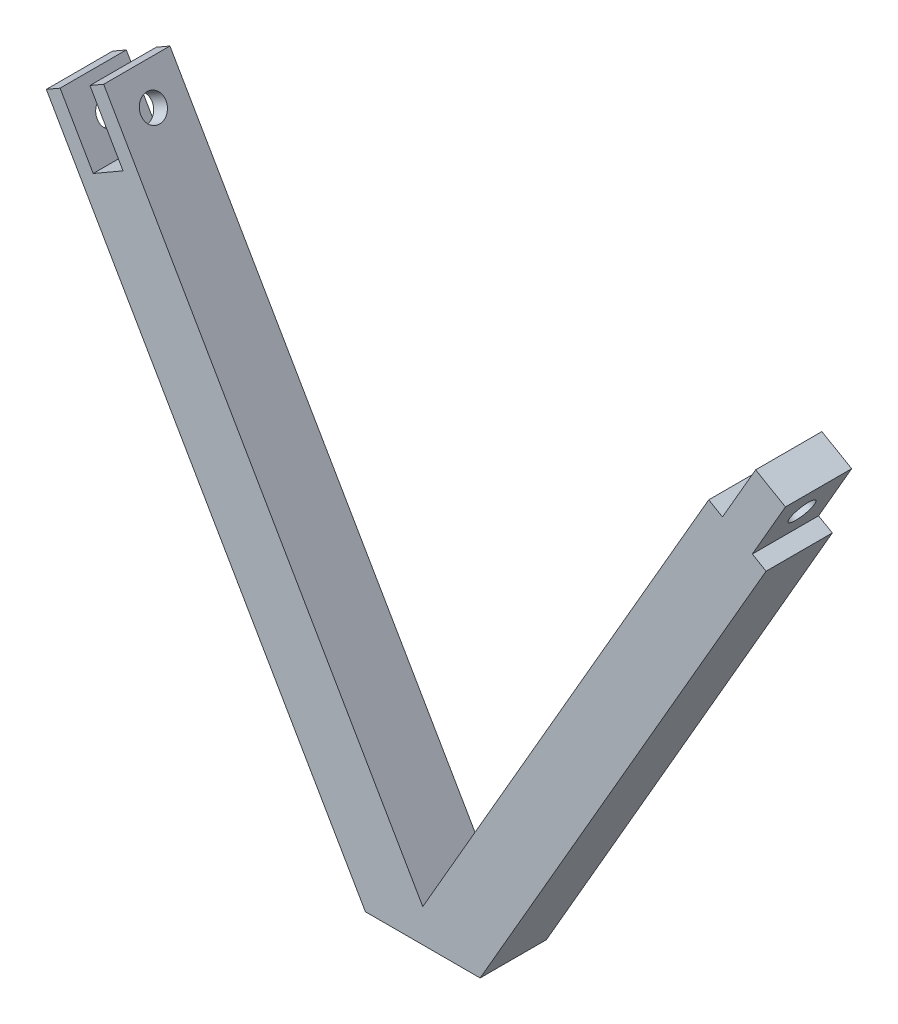
from build123d import *

# Parameters (mm, degrees)
SKETCH1_W               = 5
SKETCH1_H               = 5
SKETCH1_R               = 0.95
CENTER_DEPTH            = 1.3
RIGHTSIDE_START         = 1.3
SKETCH1_2_W             = 5
SKETCH1_2_H             = 5
SKETCH1_2_R             = 0.95
RIGHTSIDE_DEPTH         = 1.2
LEFTSIDE_START          = -1.3
SKETCH1_3_W             = 5
SKETCH1_3_H             = 5
SKETCH1_3_R             = 0.95
LEFTSIDE_DEPTH          = 1.2
SKETCH3_W               = 5
SKETCH3_H               = 5
BOSS_EXTRUDE4_DEPTH     = 47.5
CUT_EXTRUDE1_DEPTH      = 5
CIRPATTERN2_COUNT       = 6
CIRPATTERN3_COUNT       = 3
CIRPATTERN4_START       = -44.601270189
CIRPATTERN4_OUTLINE_W   = 5
CIRPATTERN4_OUTLINE_H   = 5
CIRPATTERN4_OUTLINE_R   = 0.95
CIRPATTERN4_DEPTH       = 2.6
CIRPATTERN4_2_OUTLINE_W = 5
CIRPATTERN4_2_OUTLINE_H = 5
CIRPATTERN4_2_OUTLINE_R = 0.95
CIRPATTERN4_2_DEPTH     = 2.6
CIRPATTERN4_START_2     = -1.3
CIRPATTERN4_3_OUTLINE_W = 5
CIRPATTERN4_3_OUTLINE_H = 5
CIRPATTERN4_3_OUTLINE_R = 0.95
CIRPATTERN4_3_DEPTH     = 2.6
SKETCH5_W               = 5
SKETCH5_H               = 2.6
CUT_EXTRUDE2_DEPTH      = 5
INTERSECT1_START        = -46.716333699
INTERSECT1_OUTLINE_W    = 105
INTERSECT1_OUTLINE_H    = 5
INTERSECT1_OUTLINE_R    = 0.95
INTERSECT1_DEPTH        = 49.216333699


# Read off the part's stored shape, not the designer's step: CirPattern4, Intersect1
with BuildPart() as part:
    # Sketch1 → Center (new, symmetric)
    with BuildSketch(Plane(origin=(0, 0, 0), x_dir=(1, 0, 0), z_dir=(0, 1, 0))):
        Rectangle(SKETCH1_W, SKETCH1_H)
        with Locations(Location((0, 0, 0), (0, 0, 270))):
            Circle(SKETCH1_R, mode=Mode.SUBTRACT)
    extrude(amount=CENTER_DEPTH, both=True)

    # Sketch5 → Cut-Extrude2 (cut)
    with BuildSketch(Plane(origin=(2.5, 0, 0), x_dir=(0, 0, -1), z_dir=(1, 0, 0))):
        Rectangle(SKETCH5_W, SKETCH5_H)
    extrude(amount=-CUT_EXTRUDE2_DEPTH, mode=Mode.SUBTRACT)


with BuildPart() as body_2:
    # Sketch1<2> → RightSide (new body)
    with BuildSketch(Plane(origin=(0, 0, 0), x_dir=(1, 0, 0), z_dir=(0, 1, 0)).offset(RIGHTSIDE_START)):
        Rectangle(SKETCH1_2_W, SKETCH1_2_H)
        with Locations(Location((0, 0, 0), (0, 0, 270))):
            Circle(SKETCH1_2_R, mode=Mode.SUBTRACT)
    extrude(amount=RIGHTSIDE_DEPTH)


with BuildPart() as body_3:
    # Sketch1<3> → LeftSide (new body)
    with BuildSketch(Plane(origin=(0, 0, 0), x_dir=(1, 0, 0), z_dir=(0, 1, 0)).offset(LEFTSIDE_START)):
        Rectangle(SKETCH1_3_W, SKETCH1_3_H)
        with Locations(Location((0, 0, 0), (0, 0, 270))):
            Circle(SKETCH1_3_R, mode=Mode.SUBTRACT)
    extrude(amount=-LEFTSIDE_DEPTH)


with BuildPart() as body_4:
    # Sketch3 → Boss-Extrude4 (new body)
    with BuildSketch(Plane.ZY.offset(2.5)):
        Rectangle(SKETCH3_W, SKETCH3_H)
    extrude(amount=BOSS_EXTRUDE4_DEPTH)

    # Sketch4 → Cut-Extrude1 (cut)
    with BuildSketch(Plane.XY.offset(-2.5)):
        Polygon((-50, 0), (-50, -2.5), (-45.669872981, -2.5), align=None)
        Polygon((-50, 2.5), (-50, 0), (-45.669872981, 2.5), align=None)
    extrude(amount=CUT_EXTRUDE1_DEPTH, mode=Mode.SUBTRACT)


with BuildPart() as cirpattern2_1:
    # CirPattern2: pattern copy
    add(body_4.part.rotate(Axis((-50, 0, 0), (0, 0, 1)), 1 * 360 / CIRPATTERN2_COUNT))


with BuildPart() as cirpattern2_2:
    # CirPattern2: pattern copy
    add(body_4.part.rotate(Axis((-50, 0, 0), (0, 0, 1)), 2 * 360 / CIRPATTERN2_COUNT))


with BuildPart() as cirpattern2_3:
    # CirPattern2: pattern copy
    add(body_4.part.rotate(Axis((-50, 0, 0), (0, 0, 1)), 3 * 360 / CIRPATTERN2_COUNT))


with BuildPart() as cirpattern2_4:
    # CirPattern2: pattern copy
    add(body_4.part.rotate(Axis((-50, 0, 0), (0, 0, 1)), 4 * 360 / CIRPATTERN2_COUNT))


with BuildPart() as cirpattern2_5:
    # CirPattern2: pattern copy
    add(body_4.part.rotate(Axis((-50, 0, 0), (0, 0, 1)), 5 * 360 / CIRPATTERN2_COUNT))


with BuildPart() as cirpattern3_1:
    # CirPattern3: pattern copy
    add(body_3.part.rotate(Axis((-50, 0, 0), (0, 0, 1)), 1 * 360 / CIRPATTERN3_COUNT))


with BuildPart() as cirpattern3_2:
    # CirPattern3: pattern copy
    add(body_3.part.rotate(Axis((-50, 0, 0), (0, 0, 1)), 2 * 360 / CIRPATTERN3_COUNT))


with BuildPart() as cirpattern3_3:
    # CirPattern3: pattern copy
    add(body_2.part.rotate(Axis((-50, 0, 0), (0, 0, 1)), 1 * 360 / CIRPATTERN3_COUNT))


with BuildPart() as cirpattern3_4:
    # CirPattern3: pattern copy
    add(body_2.part.rotate(Axis((-50, 0, 0), (0, 0, 1)), 2 * 360 / CIRPATTERN3_COUNT))


with BuildPart() as body_14:
    # CirPattern4 outline → CirPattern4 (new body)
    with BuildSketch(Plane(origin=(0, 0, 0), x_dir=(0.49999999999999767, 0.86602540378444, 0), z_dir=(0.8660254037844399, -0.49999999999999795, 0)).offset(CIRPATTERN4_START)):
        with Locations((25, 0)):
            Rectangle(CIRPATTERN4_OUTLINE_W, CIRPATTERN4_OUTLINE_H)
        with Locations((25, 0)):
            Circle(CIRPATTERN4_OUTLINE_R, mode=Mode.SUBTRACT)
    extrude(amount=CIRPATTERN4_DEPTH)


with BuildPart() as body_15:
    # CirPattern4 2 outline → CirPattern4 2 (new body)
    with BuildSketch(Plane(origin=(0, 0, 0), x_dir=(0.5000000000000098, -0.8660254037844329, 0), z_dir=(0.8660254037844329, 0.50000000000001, 0)).offset(CIRPATTERN4_START)):
        with Locations((25, 0)):
            Rectangle(CIRPATTERN4_2_OUTLINE_W, CIRPATTERN4_2_OUTLINE_H)
        with Locations((25, 0)):
            Circle(CIRPATTERN4_2_OUTLINE_R, mode=Mode.SUBTRACT)
    extrude(amount=CIRPATTERN4_2_DEPTH)


with BuildPart() as body_16:
    # CirPattern4 3 outline → CirPattern4 3 (new body)
    with BuildSketch(Plane(origin=(0, 0, 0), x_dir=(1, 0, 0), z_dir=(0, 1, 0)).offset(CIRPATTERN4_START_2)):
        with Locations((-100, 0)):
            Rectangle(CIRPATTERN4_3_OUTLINE_W, CIRPATTERN4_3_OUTLINE_H)
        with Locations((-100, 0)):
            Circle(CIRPATTERN4_3_OUTLINE_R, mode=Mode.SUBTRACT)
    extrude(amount=CIRPATTERN4_3_DEPTH)


with BuildPart() as cirpattern2_5_1:
    add(cirpattern2_5.part)

    # Combine1: union CirPattern2_3, CirPattern2_4, body 16, CirPattern3_2, CirPattern3_4, body 15, CirPattern2_1, body 3, body 14, body 4, body 2, CirPattern2_2, CirPattern3_1, CirPattern3_3
    add(cirpattern2_3.part)
    add(cirpattern2_4.part)
    add(body_16.part)
    add(cirpattern3_2.part)
    add(cirpattern3_4.part)
    add(body_15.part)
    add(cirpattern2_1.part)
    add(body_3.part)
    add(body_14.part)
    add(body_4.part)
    add(body_2.part)
    add(cirpattern2_2.part)
    add(cirpattern3_1.part)
    add(cirpattern3_3.part)

    # Intersect1 outline → Intersect1 (cut)
    with BuildSketch(Plane(origin=(0, 0, 0), x_dir=(1, 0, 0), z_dir=(0, 1, 0)).offset(INTERSECT1_START)):
        with Locations((-50, 0)):
            Rectangle(INTERSECT1_OUTLINE_W, INTERSECT1_OUTLINE_H)
        with Locations((-100, 0)):
            Circle(INTERSECT1_OUTLINE_R, mode=Mode.SUBTRACT)
        Circle(INTERSECT1_OUTLINE_R, mode=Mode.SUBTRACT)
    extrude(amount=INTERSECT1_DEPTH, mode=Mode.SUBTRACT)


solid = cirpattern2_5_1.part
